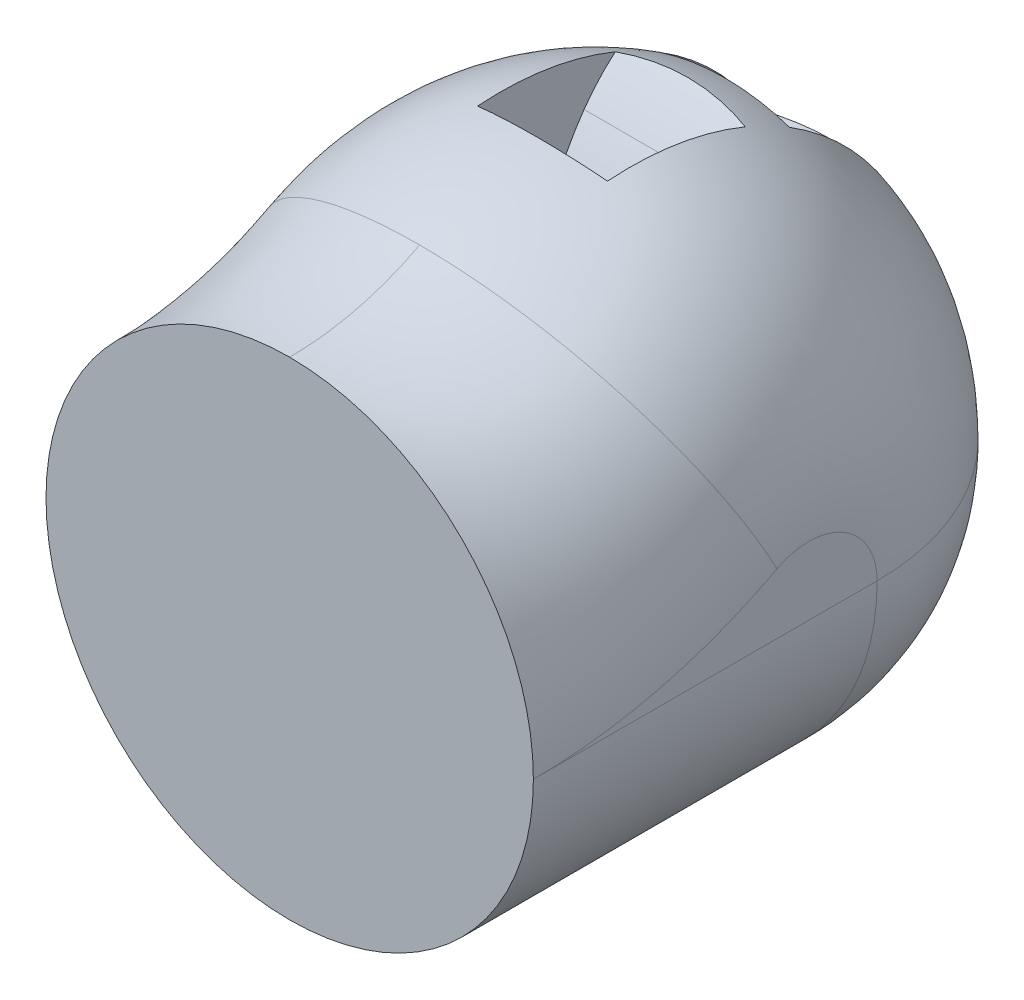
from build123d import *

# Parameters (mm, degrees)
BOSS_EXTRUDE1_DEPTH      = 18.75
BOSS_EXTRUDE1_DEPTH_BACK = 18.75
FILLET1_R                = 18.75
CUT_EXTRUDE1_DEPTH       = 5
CUT_EXTRUDE1_DEPTH_BACK  = 5


with BuildPart() as part:
    # Sketch1 → Boss-Extrude1 (new, two sides: drawn at the far end of the back side and taken through both)
    with BuildSketch(Plane(origin=(0, 0, 0), x_dir=(0, 0, -1), z_dir=(1, 0, 0)).offset(-BOSS_EXTRUDE1_DEPTH_BACK)):
        with BuildLine():
            Line((-21.199959993, 18.75), (-21.199959993, 0))
            Line((-21.199959993, 0), (24, 0))
            ThreePointArc((24, 0), (21.628103458, 10.403131298), (14.981238267, 18.75))
            Line((14.981238267, 18.75), (-21.199959993, 18.75))
        make_face()
        with BuildLine():
            ThreePointArc((-11.199959993, 21.226419768), (-16.048924785, 19.37831648), (-21.199959993, 18.75))
            Line((-21.199959993, 18.75), (14.981238267, 18.75))
            ThreePointArc((14.981238267, 18.75), (2.260017713, 23.893353049), (-11.199959993, 21.226419768))
        make_face()
        with BuildLine():
            ThreePointArc((24, 0), (18.508252147, -13.258252147), (5.25, -18.75))
            Line((5.25, -18.75), (-21.199959993, -18.75))
            Line((-21.199959993, -18.75), (-21.199959993, 0))
            Line((-21.199959993, 0), (24, 0))
        make_face()
    extrude(amount=BOSS_EXTRUDE1_DEPTH + BOSS_EXTRUDE1_DEPTH_BACK)

    # Fillet1
    fillet1_edges = [part.edges().sort_by_distance(p)[0] for p in [
        (18.75, -18.75, 7.974979997),
        (-18.75, -18.75, 7.974979997),
        (18.75, -13.258252147, -18.508252147),
        (-18.75, -13.258252147, -18.508252147),
        (18.75, 20.552360446, -12.393566076),
        (-18.75, 20.552360446, -12.393566076),
        (18.75, 19.37831648, 16.048924785),
        (-18.75, 19.37831648, 16.048924785),
    ]]
    fillet(fillet1_edges, radius=FILLET1_R - 0.0001)  # a hair under: the kernel refuses the full size

    # Sketch2 → Cut-Extrude1 (cut, two sides: drawn at the far end of the back side and taken through both)
    with BuildSketch(Plane(origin=(0, 0, 0), x_dir=(0, 0, -1), z_dir=(1, 0, 0)).offset(-CUT_EXTRUDE1_DEPTH_BACK)):
        with BuildLine():
            ThreePointArc((6.449036598, 18.931717486), (5.121740793, 16.758420159), (4.08141286, 14.434059341))
            ThreePointArc((4.08141286, 14.434059341), (2.346516976, 14.815325109), (0.578715338, 14.988832128))
            ThreePointArc((0.578715338, 14.988832128), (0.307571672, 17.520909641), (-0.283175845, 19.997995186))
            ThreePointArc((-0.283175845, 19.997995186), (-1.077578354, 22.021879435), (-2.170046216, 23.901692397))
            ThreePointArc((-2.170046216, 23.901692397), (52.177632289, 26.585831545), (18.061354181, -15.804666563))
            ThreePointArc((18.061354181, -15.804666563), (17.182690047, -13.815915161), (16.012271373, -11.983620717))
            ThreePointArc((16.012271373, -11.983620717), (14.35549975, -10.049701585), (12.466380259, -8.34202393))
            ThreePointArc((12.466380259, -8.34202393), (13.365097847, -6.809857488), (14.076393592, -5.182194847))
            ThreePointArc((14.076393592, -5.182194847), (16.568330412, -5.706776879), (19.106729783, -5.910404133))
            ThreePointArc((19.106729783, -5.910404133), (21.277041962, -5.780297079), (23.402441464, -5.322192551))
            ThreePointArc((23.402441464, -5.322192551), (23.704520174, -3.754427161), (23.901692397, -2.170046216))
            ThreePointArc((23.901692397, -2.170046216), (22.021879435, -1.077578354), (19.997995186, -0.283175845))
            ThreePointArc((19.997995186, -0.283175845), (17.520909641, 0.307571672), (14.988832128, 0.578715338))
            ThreePointArc((14.988832128, 0.578715338), (14.815325109, 2.346516975), (14.434059341, 4.08141286))
            ThreePointArc((14.434059341, 4.08141286), (16.75842016, 5.121740793), (18.931717486, 6.449036598))
            ThreePointArc((18.931717486, 6.449036598), (20.611061914, 7.829972908), (22.061279145, 9.449865739))
            ThreePointArc((22.061279145, 9.449865739), (21.384156581, 10.895771994), (20.612396506, 12.293458028))
            ThreePointArc((20.612396506, 12.293458028), (18.449459375, 12.072356759), (16.345164544, 11.525432574))
            ThreePointArc((16.345164544, 11.525432574), (13.993927564, 10.547363003), (11.786059576, 9.278405017))
            ThreePointArc((11.786059576, 9.278405017), (10.606601718, 10.606601718), (9.278405018, 11.786059576))
            ThreePointArc((9.278405018, 11.786059576), (10.547363004, 13.993927564), (11.525432575, 16.345164544))
            ThreePointArc((11.525432575, 16.345164544), (12.072356759, 18.449459375), (12.293458029, 20.612396506))
            ThreePointArc((12.293458029, 20.612396506), (10.895771994, 21.384156581), (9.449865739, 22.061279145))
            ThreePointArc((9.449865739, 22.061279145), (7.829972908, 20.611061914), (6.449036598, 18.931717486))
        make_face()
    extrude(amount=CUT_EXTRUDE1_DEPTH + CUT_EXTRUDE1_DEPTH_BACK, mode=Mode.SUBTRACT)


solid = part.part
